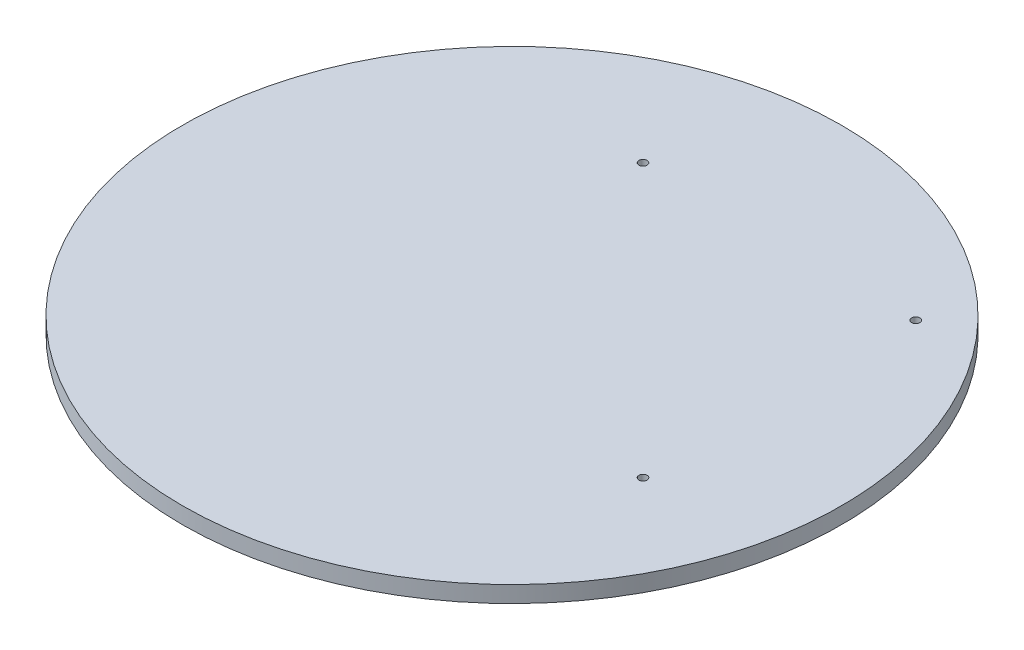
from build123d import *

# Parameters (mm, degrees)
SKETCH1_R           = 200
SKETCH1_R_2         = 2.5
BOSS_EXTRUDE1_DEPTH = 10


with BuildPart() as part:
    # Sketch1 → Boss-Extrude1 (new body)
    with BuildSketch(Plane(origin=(0, 0, 0), x_dir=(1, 0, 0), z_dir=(0, 1, 0))):
        Circle(SKETCH1_R)
        with Locations((125, 120)):
            Circle(SKETCH1_R_2, mode=Mode.SUBTRACT)
        with Locations((-40.5, 120)):
            Circle(SKETCH1_R_2, mode=Mode.SUBTRACT)
        with Locations((125, -45.5)):
            Circle(SKETCH1_R_2, mode=Mode.SUBTRACT)
    extrude(amount=BOSS_EXTRUDE1_DEPTH)


solid = part.part
